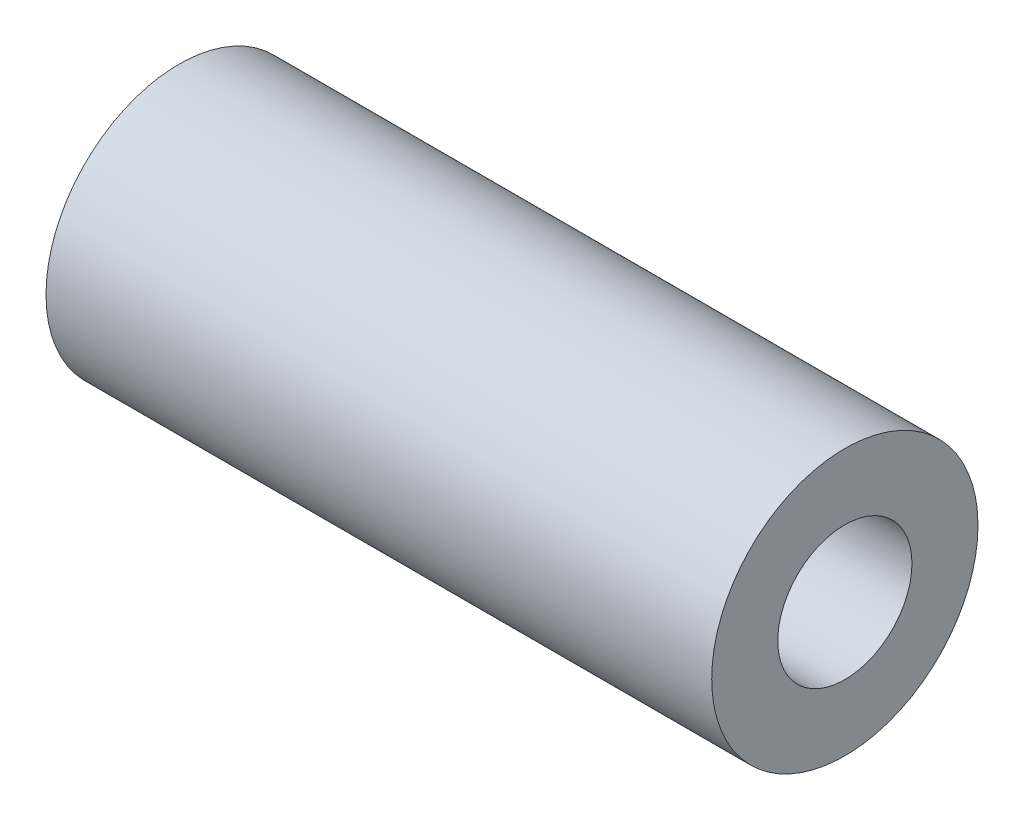
from build123d import *

# Parameters (mm, degrees)
SKETCH1_R           = 6.35
SKETCH1_R_2         = 3.2004
BOSS_EXTRUDE1_DEPTH = 31.75


with BuildPart() as part:
    # Sketch1 → Boss-Extrude1 (new body)
    with BuildSketch(Plane(origin=(0, 0, 0), x_dir=(0, 0, -1), z_dir=(1, 0, 0))):
        Circle(SKETCH1_R)
        Circle(SKETCH1_R_2, mode=Mode.SUBTRACT)
    extrude(amount=BOSS_EXTRUDE1_DEPTH)


solid = part.part
